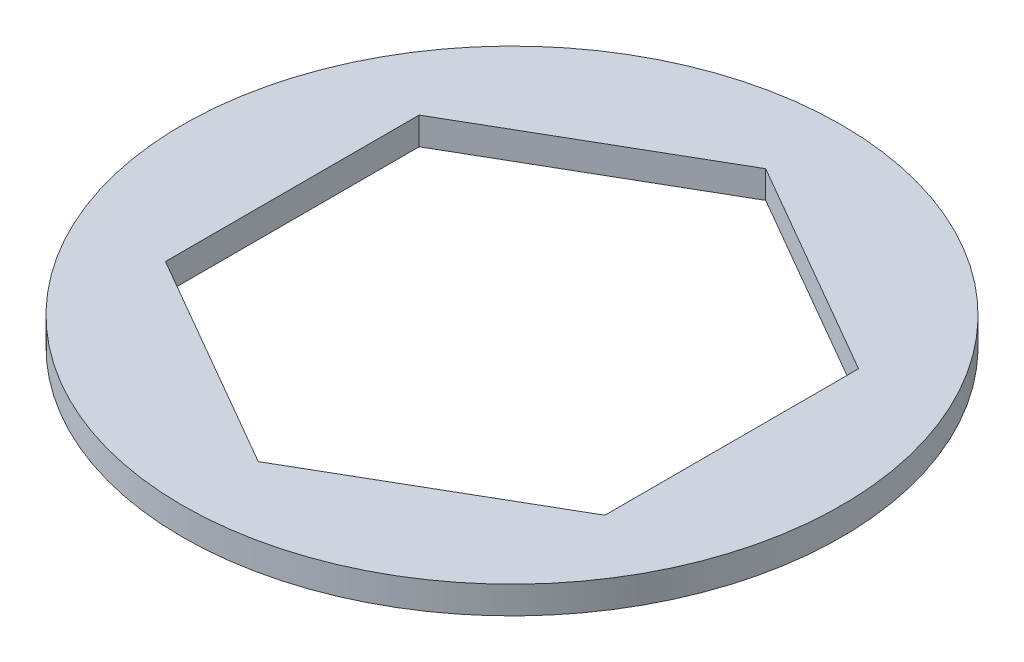
from build123d import *

# Parameters (mm, degrees)
SKETCH1_R           = 9.525
BOSS_EXTRUDE1_DEPTH = 0.79375


with BuildPart() as part:
    # Sketch1 → Boss-Extrude1 (new body)
    with BuildSketch(Plane(origin=(0, 0, 0), x_dir=(1, 0, 0), z_dir=(0, 1, 0))):
        Circle(SKETCH1_R)
        Polygon((6.35, 3.666174209), (0, 7.332348419), (-6.35, 3.666174209), (-6.35, -3.666174209), (0, -7.332348419), (6.35, -3.666174209), align=None, mode=Mode.SUBTRACT)
    extrude(amount=BOSS_EXTRUDE1_DEPTH)


solid = part.part
